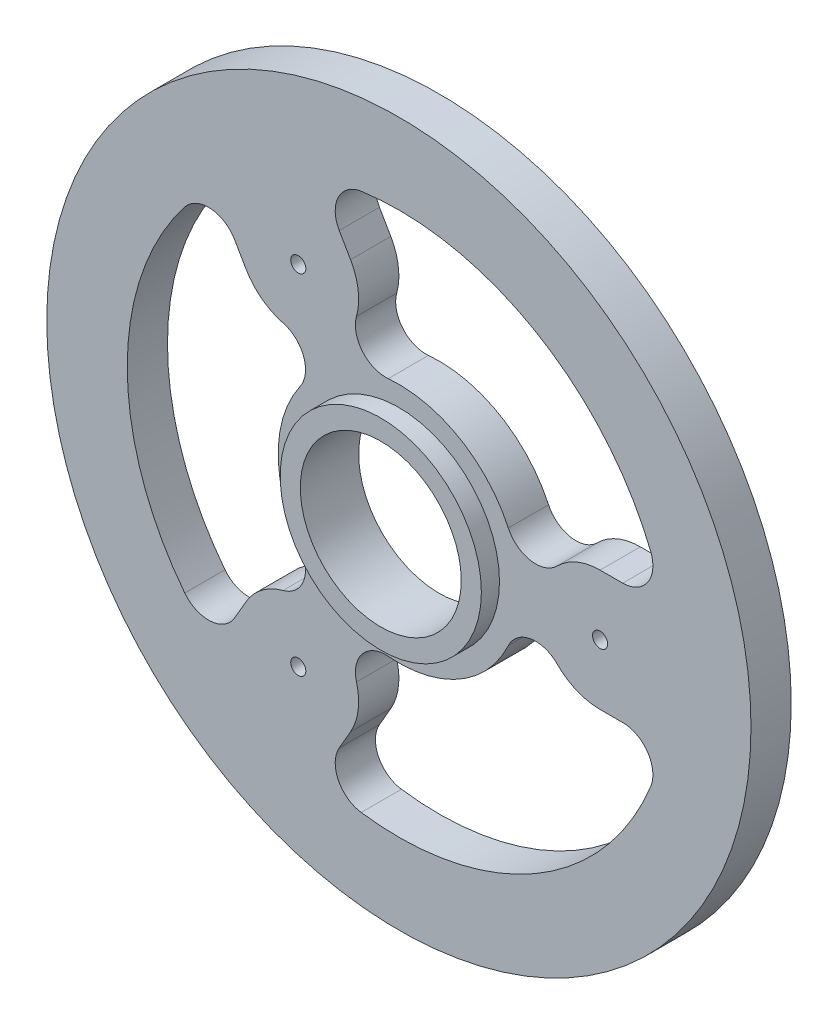
from build123d import *

# Parameters (mm, degrees)
M1X0_25_1_D         = 0.75
CUT_EXTRUDE_START   = -2
CUT_EXTRUDE_1_DEPTH = 2
FILLET_1_R          = 1.5


# Read off the part's stored shape, not the designer's step: ｶｯﾄ - 押し出し1
with BuildPart() as part:
    # ｽｹｯﾁ1 → 回転1 (revolve)
    with BuildSketch(Plane(origin=(0, 0, 0), x_dir=(0, 0, -1), z_dir=(1, 0, 0)), mode=Mode.PRIVATE) as revolve_1_sk:
        Polygon((0, 4), (2.9, 4), (2.9, 17.5), (0.9, 17.5), (0.9, 5), (0, 5), align=None)
    revolve(revolve_1_sk.sketch.rotate(Axis((0, 0, 0), (0, 0, -1)), 90), axis=Axis((0, 0, 0), (0, 0, -1)))

    # M1x0.25 ねじ穴1 (through all)
    with Locations(Plane.XY.offset(-0.9)):
        with Locations((9.999999803, 0), (-5, 8.660254038), (-5.000000098, -8.660253981)):
            Hole(M1X0_25_1_D / 2)

    # ｶｯﾄ - 押し出し1 outline → ｶｯﾄ - 押し出し1 (cut)
    with BuildSketch(Plane.XY.offset(-0.9).offset(CUT_EXTRUDE_START)):
        with BuildLine():
            ThreePointArc((-4.91198547, -3.445634737), (-6, 0), (-4.91198547, 3.445634737))
            ThreePointArc((-4.91198547, 3.445634737), (-4.731685773, 4.823475601), (-5.759987903, 5.758113582))
            ThreePointArc((-5.759987903, 5.758113582), (-6.819518607, 6.275017773), (-7.598076211, 7.160254038))
            Line((-7.598076211, 7.160254038), (-9.179299502, 9.899013115))
            ThreePointArc((-9.179299502, 9.899013115), (-13.5, 8.7e-08), (-9.17929963, -9.899012996))
            Line((-9.17929963, -9.899012996), (-7.59807631, -7.160253868))
            ThreePointArc((-7.59807631, -7.160253868), (-6.819518691, -6.275017592), (-5.759987933, -5.758113538))
            ThreePointArc((-5.759987933, -5.758113538), (-4.731685776, -4.823475609), (-4.91198547, -3.445634737))
        make_face()
        with BuildLine():
            ThreePointArc((5.43999995, -2.531086831), (3, -5.196152423), (-0.52801448, -5.976721569))
            ThreePointArc((-0.52801448, -5.976721569), (-1.811409498, -6.509497859), (-2.106678705, -7.86735258))
            ThreePointArc((-2.106678705, -7.86735258), (-2.024565604, -9.043385134), (-2.401923887, -10.160253868))
            Line((-2.401923887, -10.160253868), (-3.983147246, -12.899013064))
            ThreePointArc((-3.983147246, -12.899013064), (6.749999924, -11.691342995), (13.162446581, -3))
            Line((13.162446581, -3), (9.999999803, -3))
            ThreePointArc((9.999999803, -3), (8.84408395, -2.768367486), (7.866666559, -2.109239026))
            ThreePointArc((7.866666559, -2.109239026), (6.543095269, -1.686022286), (5.43999995, -2.531086831))
        make_face()
        with BuildLine():
            ThreePointArc((-0.52801448, 5.976721569), (3, 5.196152423), (5.43999995, 2.531086831))
            ThreePointArc((5.43999995, 2.531086831), (6.543095269, 1.686022286), (7.866666559, 2.109239026))
            ThreePointArc((7.866666559, 2.109239026), (8.84408395, 2.768367486), (9.999999803, 3))
            Line((9.999999803, 3), (13.162446581, 3))
            ThreePointArc((13.162446581, 3), (6.75, 11.691342951), (-3.983147079, 12.899013115))
            Line((-3.983147079, 12.899013115), (-2.401923789, 10.160254038))
            ThreePointArc((-2.401923789, 10.160254038), (-2.024565497, 9.043385242), (-2.106678823, 7.867352678))
            ThreePointArc((-2.106678823, 7.867352678), (-1.811409518, 6.509497883), (-0.52801448, 5.976721569))
        make_face()
    extrude(amount=CUT_EXTRUDE_1_DEPTH, mode=Mode.SUBTRACT)

    # ﾌｨﾚｯﾄ1
    fillet_1_edges = [part.edges().sort_by_distance(p)[0] for p in [
        (-9.17929963, -9.899012996, -1.9),
        (-9.179299502, 9.899013115, -1.9),
        (-3.983147079, 12.899013115, -1.9),
        (13.162446581, 3, -1.9),
        (13.162446581, -3, -1.9),
        (-3.983147246, -12.899013064, -1.9),
    ]]
    fillet(fillet_1_edges, radius=FILLET_1_R)


solid = part.part
